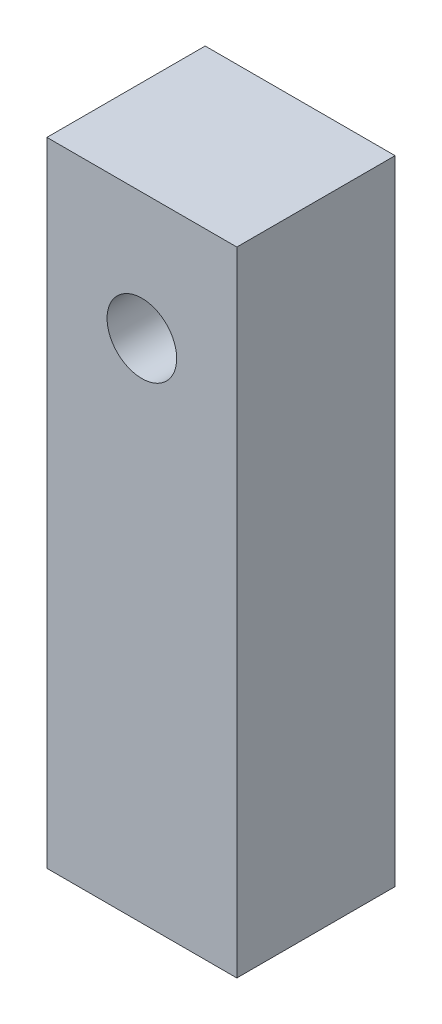
from build123d import *

# Parameters (mm, degrees)
SKETCH1_W           = 6
SKETCH1_H           = 5
BOSS_EXTRUDE1_DEPTH = 20
SKETCH2_R           = 1.1
CUT_EXTRUDE1_DEPTH  = 20


with BuildPart() as part:
    # Sketch1 → Boss-Extrude1 (new body)
    with BuildSketch(Plane(origin=(0, 0, 0), x_dir=(1, 0, 0), z_dir=(0, 1, 0))):
        with Locations((0.95450664, 1.978089534)):
            Rectangle(SKETCH1_W, SKETCH1_H)
    extrude(amount=BOSS_EXTRUDE1_DEPTH)

    # Sketch2 → Cut-Extrude1 (cut)
    with BuildSketch(Plane.XY.offset(0.521910466)):
        with Locations((0.95450664, 16)):
            Circle(SKETCH2_R)
    extrude(amount=-CUT_EXTRUDE1_DEPTH, mode=Mode.SUBTRACT)


solid = part.part
